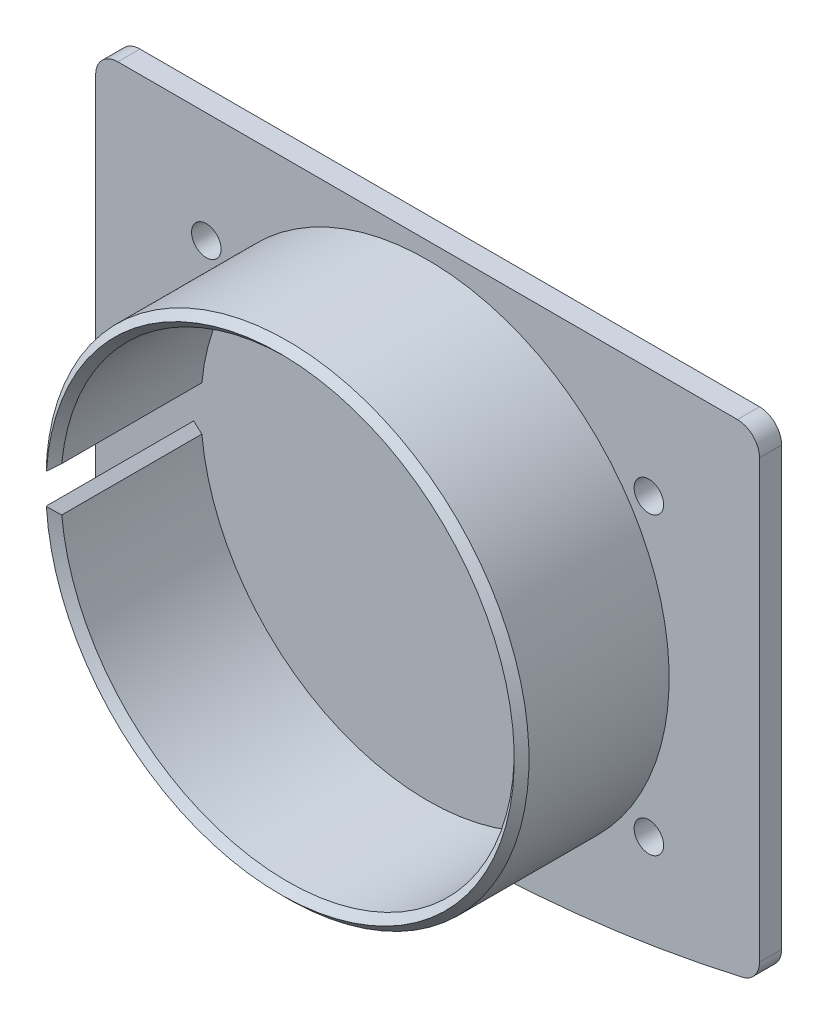
from build123d import *

# Parameters (mm, degrees)
SKETCH_2_W          = 90
SKETCH_2_H          = 70
EXTRUDE_2_DEPTH     = 3
SKETCH_3_R          = 2
CUT_EXTRUDE_1_DEPTH = 3
SKETCH_4_R          = 32.75
SKETCH_4_R_2        = 30.75
EXTRUDE_3_DEPTH     = 20
SKETCH_5_W          = 3
SKETCH_5_H          = 4
CUT_EXTRUDE_2_DEPTH = 20
CHAMFER_1_SIZE      = 1
CHAMFER_2_SIZE      = 1
CHAMFER_2_SIZE_2    = 1.07199294
FILLET_1_R          = 3
CUT_EXTRUDE_START   = -4
CUT_EXTRUDE_3_DEPTH = 5
FILLET_2_R          = 3


with BuildPart() as part:
    # 草图2 → 凸台-拉伸2 (new body)
    with BuildSketch(Plane.XY):
        Rectangle(SKETCH_2_W, SKETCH_2_H)
    extrude(amount=EXTRUDE_2_DEPTH)

    # 草图3 → 切除-拉伸1 (cut)
    with BuildSketch(Plane.XY.offset(3)):
        with Locations((-30, 20)):
            Circle(SKETCH_3_R)
        with Locations((-30, -20)):
            Circle(SKETCH_3_R)
        with Locations((30, -20)):
            Circle(SKETCH_3_R)
        with Locations((30, 20)):
            Circle(SKETCH_3_R)
    extrude(amount=-CUT_EXTRUDE_1_DEPTH, mode=Mode.SUBTRACT)

    # 草图4 → 凸台-拉伸3 (add)
    with BuildSketch(Plane.XY.offset(3)):
        Circle(SKETCH_4_R)
        Circle(SKETCH_4_R_2, mode=Mode.SUBTRACT)
    extrude(amount=EXTRUDE_3_DEPTH)

    # 草图5 → 切除-拉伸2 (cut)
    with BuildSketch(Plane.XY.offset(23)):
        with Locations((-31.5, 0)):
            Rectangle(SKETCH_5_W, SKETCH_5_H)
    extrude(amount=-CUT_EXTRUDE_2_DEPTH, mode=Mode.SUBTRACT)

    # 倒角1
    chamfer_1_edges = [part.edges().sort_by_distance(p)[0] for p in [
        (1.000466936, -32.734714997, 23),
        (1.000529767, 30.733718294, 23),
    ]]
    chamfer(chamfer_1_edges, length=CHAMFER_1_SIZE - 0.0001)  # a hair under: the kernel refuses the full size

    # 倒角2
    # the kernel refuses this chamfer: 1.07199294, 1, 0.94410674 mm, written as the material it takes off along each edge
    with BuildSketch(Plane(origin=(-32.688874254, -2, 24.571782988), x_dir=(0.07527193503406021, -0.997163043737697, 0), z_dir=(0, 0, -1))) as chamfer_2_piece_1:
        with BuildLine():
            Line((0.932457463, 0), (CHAMFER_2_SIZE * 0.0752719350341, -CHAMFER_2_SIZE * 0.997163043738))
            Line((CHAMFER_2_SIZE * 0.0752719350341, -CHAMFER_2_SIZE * 0.997163043738), (0, 0))
            ThreePointArc((0, 0), (0.479261525, 0.003316189), (0.932457463, 0))
        make_face()
    extrude(amount=21.571782988, mode=Mode.SUBTRACT)
    with BuildSketch(Plane(origin=(-30.684890419, -2, 24.761558832), x_dir=(-1, 0, 0), z_dir=(0, 0, -1))) as chamfer_2_piece_2:
        with BuildLine():
            Line((CHAMFER_2_SIZE_2, 0), (-0.08291501, -1.013569498))
            ThreePointArc((-0.08291501, -1.013569498), (-0.038528119, -0.522494358), (0, 0))
            Line((0, 0), (CHAMFER_2_SIZE_2, 0))
        make_face()
    extrude(amount=21.761558832, mode=Mode.SUBTRACT)
    with BuildSketch(Plane(origin=(-32.688874254, 2, 24.571782988), x_dir=(1, 0, 0), z_dir=(0, 0, -1))) as chamfer_2_piece_3:
        with BuildLine():
            Line((CHAMFER_2_SIZE, 0), (0.070187878, -0.929812122))
            ThreePointArc((0.070187878, -0.929812122), (0.032768161, -0.478151497), (0, 0))
            Line((0, 0), (CHAMFER_2_SIZE, 0))
        make_face()
    extrude(amount=21.571782988, mode=Mode.SUBTRACT)
    with BuildSketch(Plane(origin=(-30.684890419, 2, 24.761558832), x_dir=(0.08153260293948016, 0.9966706751269013, 0), z_dir=(0, 0, -1))) as chamfer_2_piece_4:
        with BuildLine():
            Line((1.016955273, 0), (-CHAMFER_2_SIZE_2 * 0.081532602904, -CHAMFER_2_SIZE_2 * 0.996670674693))
            Line((-CHAMFER_2_SIZE_2 * 0.081532602904, -CHAMFER_2_SIZE_2 * 0.996670674693), (0, 0))
            ThreePointArc((0, 0), (0.523896102, -0.004200479), (1.016955273, 0))
        make_face()
    extrude(amount=21.761558832, mode=Mode.SUBTRACT)

    # 圆角1
    fillet_1_edges = [part.edges().sort_by_distance(p)[0] for p in [
        (-45, 35, 1.5),
        (45, 35, 1.5),
        (45, -35, 1.5),
        (-45, -35, 1.5),
    ]]
    fillet(fillet_1_edges, radius=FILLET_1_R)

    # 切除-拉伸3: read off the stored shape, not the designer's step
    # 切除-拉伸3 outline → 切除-拉伸3 (cut)
    with BuildSketch(Plane.XY.offset(3).offset(CUT_EXTRUDE_START)):
        with BuildLine():
            Line((45, -32), (45, -29.59414942))
            ThreePointArc((45, -29.59414942), (22.661769286, -33.643696457), (-7.97e-07, -35))
            Line((-7.97e-07, -35), (42, -35))
            ThreePointArc((42, -35), (44.121320344, -34.121320344), (45, -32))
        make_face()
        with BuildLine():
            Line((-42, -35), (-7.97e-07, -35))
            ThreePointArc((-7.97e-07, -35), (-22.661770078, -33.643696362), (-45, -29.59414942))
            Line((-45, -29.59414942), (-45, -32))
            ThreePointArc((-45, -32), (-44.121320344, -34.121320344), (-42, -35))
        make_face()
    extrude(amount=CUT_EXTRUDE_3_DEPTH, mode=Mode.SUBTRACT)

    # 圆角2
    fillet_2_edges = [part.edges().sort_by_distance(p)[0] for p in [
        (45, -29.59414942, 1.5),
        (-45, -29.59414942, 1.5),
    ]]
    fillet(fillet_2_edges, radius=FILLET_2_R)


solid = part.part
